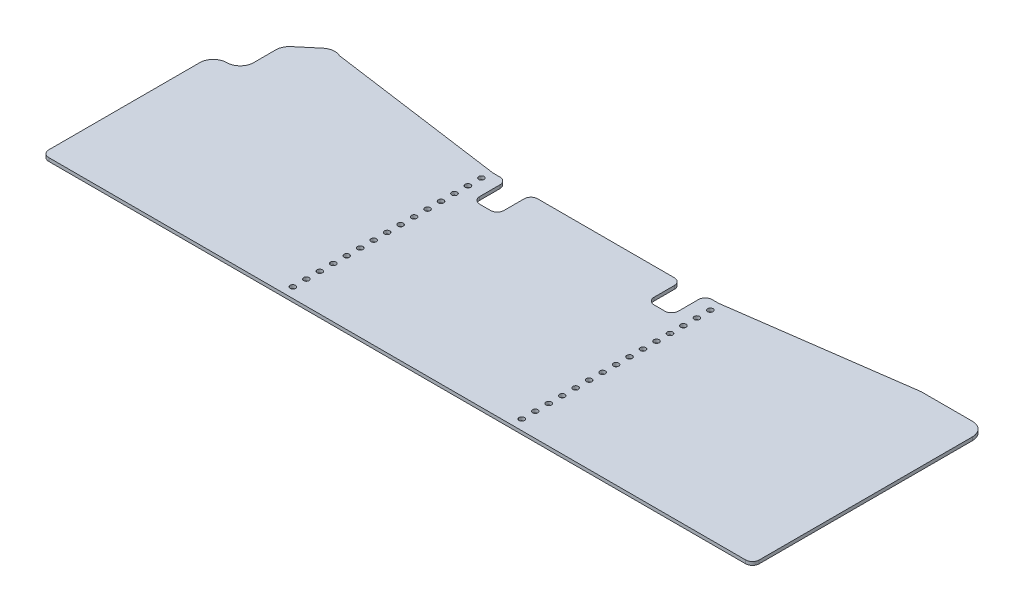
from build123d import *

# Parameters (mm, degrees)
SKETCH1_W           = 225.425
SKETCH1_H           = 196.85
SKETCH1_R           = 2.5527
BOSS_EXTRUDE1_DEPTH = 3.175
FILLET1_R           = 6.35
SKETCH2_W           = 22.86
SKETCH2_H           = 31.75
CUT_EXTRUDE1_DEPTH  = 300.293223695
FILLET2_R           = 6.35
BOSS_EXTRUDE2_DEPTH = 3.175
FILLET3_R           = 6.35
SKETCH4_R           = 2.4892
CUT_EXTRUDE2_DEPTH  = 520.25515638
CUT_EXTRUDE3_DEPTH  = 520.25515638
FILLET4_R           = 12.7
FILLET5_R           = 12.7
CUT_EXTRUDE4_DEPTH  = 520.25515638
FILLET6_R           = 12.7


with BuildPart() as part:
    # Sketch1 → Boss-Extrude1 (new body)
    with BuildSketch(Plane(origin=(0, 0, 0), x_dir=(1, 0, 0), z_dir=(0, 1, 0))):
        with Locations((112.7125, 98.425)):
            Rectangle(SKETCH1_W, SKETCH1_H)
        with Locations(Location((4.7625, 187.325, 0), (0, 0, 270))):
            Circle(SKETCH1_R, mode=Mode.SUBTRACT)
        with Locations(Location((4.7625, 174.625, 0), (0, 0, 270))):
            Circle(SKETCH1_R, mode=Mode.SUBTRACT)
        with Locations(Location((4.7625, 161.925, 0), (0, 0, 270))):
            Circle(SKETCH1_R, mode=Mode.SUBTRACT)
        with Locations(Location((4.7625, 149.225, 0), (0, 0, 270))):
            Circle(SKETCH1_R, mode=Mode.SUBTRACT)
        with Locations(Location((4.7625, 136.525, 0), (0, 0, 270))):
            Circle(SKETCH1_R, mode=Mode.SUBTRACT)
        with Locations(Location((4.7625, 123.825, 0), (0, 0, 270))):
            Circle(SKETCH1_R, mode=Mode.SUBTRACT)
        with Locations(Location((220.6625, 123.825, 0), (0, 0, 90))):
            Circle(SKETCH1_R, mode=Mode.SUBTRACT)
        with Locations(Location((220.6625, 136.525, 0), (0, 0, 90))):
            Circle(SKETCH1_R, mode=Mode.SUBTRACT)
        with Locations(Location((220.6625, 149.225, 0), (0, 0, 90))):
            Circle(SKETCH1_R, mode=Mode.SUBTRACT)
        with Locations(Location((220.6625, 161.925, 0), (0, 0, 90))):
            Circle(SKETCH1_R, mode=Mode.SUBTRACT)
        with Locations(Location((220.6625, 174.625, 0), (0, 0, 90))):
            Circle(SKETCH1_R, mode=Mode.SUBTRACT)
        with Locations(Location((220.6625, 187.325, 0), (0, 0, 90))):
            Circle(SKETCH1_R, mode=Mode.SUBTRACT)
        with Locations(Location((4.7625, 111.125, 0), (0, 0, 270))):
            Circle(SKETCH1_R, mode=Mode.SUBTRACT)
        with Locations(Location((4.7625, 98.425, 0), (0, 0, 270))):
            Circle(SKETCH1_R, mode=Mode.SUBTRACT)
        with Locations(Location((4.7625, 85.725, 0), (0, 0, 270))):
            Circle(SKETCH1_R, mode=Mode.SUBTRACT)
        with Locations(Location((4.7625, 73.025, 0), (0, 0, 270))):
            Circle(SKETCH1_R, mode=Mode.SUBTRACT)
        with Locations(Location((4.7625, 60.325, 0), (0, 0, 270))):
            Circle(SKETCH1_R, mode=Mode.SUBTRACT)
        with Locations(Location((4.7625, 47.625, 0), (0, 0, 270))):
            Circle(SKETCH1_R, mode=Mode.SUBTRACT)
        with Locations(Location((4.7625, 34.925, 0), (0, 0, 270))):
            Circle(SKETCH1_R, mode=Mode.SUBTRACT)
        with Locations(Location((4.7625, 22.225, 0), (0, 0, 270))):
            Circle(SKETCH1_R, mode=Mode.SUBTRACT)
        with Locations(Location((4.7625, 9.525, 0), (0, 0, 270))):
            Circle(SKETCH1_R, mode=Mode.SUBTRACT)
        with Locations(Location((220.6625, 111.125, 0), (0, 0, 90))):
            Circle(SKETCH1_R, mode=Mode.SUBTRACT)
        with Locations(Location((220.6625, 98.425, 0), (0, 0, 90))):
            Circle(SKETCH1_R, mode=Mode.SUBTRACT)
        with Locations(Location((220.6625, 85.725, 0), (0, 0, 90))):
            Circle(SKETCH1_R, mode=Mode.SUBTRACT)
        with Locations(Location((220.6625, 73.025, 0), (0, 0, 90))):
            Circle(SKETCH1_R, mode=Mode.SUBTRACT)
        with Locations(Location((220.6625, 60.325, 0), (0, 0, 90))):
            Circle(SKETCH1_R, mode=Mode.SUBTRACT)
        with Locations(Location((220.6625, 47.625, 0), (0, 0, 90))):
            Circle(SKETCH1_R, mode=Mode.SUBTRACT)
        with Locations(Location((220.6625, 34.925, 0), (0, 0, 90))):
            Circle(SKETCH1_R, mode=Mode.SUBTRACT)
        with Locations(Location((220.6625, 22.225, 0), (0, 0, 90))):
            Circle(SKETCH1_R, mode=Mode.SUBTRACT)
        with Locations(Location((220.6625, 9.525, 0), (0, 0, 90))):
            Circle(SKETCH1_R, mode=Mode.SUBTRACT)
    extrude(amount=BOSS_EXTRUDE1_DEPTH)

    # Fillet1
    fillet1_edges = [part.edges().sort_by_distance(p)[0] for p in [
        (0, 1.5875, -196.85),
        (225.425, 1.5875, -196.85),
        (225.425, 1.5875, 0),
        (0, 1.5875, 0),
    ]]
    fillet(fillet1_edges, radius=FILLET1_R)

    # Sketch2 → Cut-Extrude1 (cut, through all)
    with BuildSketch(Plane(origin=(0, 3.175, 0), x_dir=(1, 0, 0), z_dir=(0, 1, 0))):
        with Locations((30.48, 180.975)):
            Rectangle(SKETCH2_W, SKETCH2_H)
        with Locations((194.945, 180.975)):
            Rectangle(SKETCH2_W, SKETCH2_H)
    extrude(amount=-CUT_EXTRUDE1_DEPTH, mode=Mode.SUBTRACT)

    # Fillet2
    fillet2_edges = [part.edges().sort_by_distance(p)[0] for p in [
        (19.05, 1.5875, -165.1),
        (19.05, 1.5875, -196.85),
        (41.91, 1.5875, -196.85),
        (41.91, 1.5875, -165.1),
        (183.515, 1.5875, -196.85),
        (206.375, 1.5875, -196.85),
        (206.375, 1.5875, -165.1),
        (183.515, 1.5875, -165.1),
    ]]
    fillet(fillet2_edges, radius=FILLET2_R)

    # Sketch3 → Boss-Extrude2 (add)
    with BuildSketch(Plane(origin=(0, 3.175, 0), x_dir=(1, 0, 0), z_dir=(0, 1, 0))):
        with BuildLine():
            ThreePointArc((0, 6.35), (1.859871939, 1.859871939), (6.35, 0))
            Line((6.35, 0), (-222.25, 0))
            Line((-222.25, 0), (-222.25, 263.064500032))
            Line((-222.25, 263.064500032), (-166.6875, 263.064500032))
            Line((-166.6875, 263.064500032), (-166.6875, 220.934871939))
            Line((-166.6875, 220.934871939), (6.35, 196.85))
            ThreePointArc((6.35, 196.85), (1.859871939, 194.990128061), (0, 190.5))
            Line((0, 190.5), (0, 6.35))
        make_face()
        with BuildLine():
            Line((392.1125, 220.934871939), (219.075, 196.85))
            ThreePointArc((219.075, 196.85), (223.565128061, 194.990128061), (225.425, 190.5))
            Line((225.425, 190.5), (225.425, 6.35))
            ThreePointArc((225.425, 6.35), (223.565128061, 1.859871939), (219.075, 0))
            Line((219.075, 0), (447.675, 0))
            Line((447.675, 0), (447.675, 263.064500032))
            Line((447.675, 263.064500032), (392.1125, 263.064500032))
            Line((392.1125, 263.064500032), (392.1125, 220.934871939))
        make_face()
    extrude(amount=-BOSS_EXTRUDE2_DEPTH)

    # Fillet3
    fillet3_edges = [part.edges().sort_by_distance(p)[0] for p in [
        (219.075, 1.5875, -196.85),
        (6.35, 1.5875, -196.85),
        (-222.25, 1.5875, 0),
        (-222.25, 1.5875, -263.064500032),
        (-166.6875, 1.5875, -263.064500032),
        (-166.6875, 1.5875, -220.934871939),
        (447.675, 1.5875, 0),
        (447.675, 1.5875, -263.064500032),
        (392.1125, 1.5875, -263.064500032),
        (392.1125, 1.5875, -220.934871939),
    ]]
    fillet(fillet3_edges, radius=FILLET3_R)

    # Sketch4 → Cut-Extrude2 (cut, through all)
    with BuildSketch(Plane(origin=(0, 3.175, 0), x_dir=(1, 0, 0), z_dir=(0, 1, 0))):
        with Locations(Location((-211.1375, 256.714500032, 0), (0, 0, 270))):
            Circle(SKETCH4_R)
        with Locations((-223.8375, 256.714500032)):
            Circle(SKETCH4_R)
        with Locations(Location((-198.4375, 256.714500032, 0), (0, 0, 270))):
            Circle(SKETCH4_R)
        with Locations(Location((-185.7375, 256.714500032, 0), (0, 0, 270))):
            Circle(SKETCH4_R)
        with Locations(Location((411.1625, 256.714500032, 0), (0, 0, 270))):
            Circle(SKETCH4_R)
        with Locations(Location((423.8625, 256.714500032, 0), (0, 0, 270))):
            Circle(SKETCH4_R)
        with Locations(Location((436.5625, 256.714500032, 0), (0, 0, 270))):
            Circle(SKETCH4_R)
        with Locations((449.2625, 256.714500032)):
            Circle(SKETCH4_R)
    extrude(amount=-CUT_EXTRUDE2_DEPTH, mode=Mode.SUBTRACT)

    # Sketch5 → Cut-Extrude3 (cut, through all)
    with BuildSketch(Plane(origin=(0, 3.175, 0), x_dir=(1, 0, 0), z_dir=(0, 1, 0))):
        with BuildLine():
            Line((-196.85, 201.06223924), (-166.6875, 226.46223924))
            Line((-166.6875, 226.46223924), (-166.6875, 256.714500032))
            ThreePointArc((-166.6875, 256.714500032), (-168.547371939, 261.204628093), (-173.0375, 263.064500032))
            Line((-173.0375, 263.064500032), (-215.9, 263.064500032))
            ThreePointArc((-215.9, 263.064500032), (-219.742708963, 261.769802973), (-222.01844344, 258.413661552))
            ThreePointArc((-222.01844344, 258.413661552), (-221.353386843, 256.55544512), (-222.25, 254.797220608))
            Line((-222.25, 254.797220608), (-222.25, 161.464500032))
            Line((-222.25, 161.464500032), (-196.85, 161.464500032))
            Line((-196.85, 161.464500032), (-196.85, 201.06223924))
        make_face()
    extrude(amount=-CUT_EXTRUDE3_DEPTH, mode=Mode.SUBTRACT)

    # Fillet4
    fillet4_edges = [part.edges().sort_by_distance(p)[0] for p in [
        (-166.6875, 1.5875, -226.46223924),
    ]]
    fillet(fillet4_edges, radius=FILLET4_R)

    # Fillet5
    # the kernel refuses this fillet: 12.7 mm, written as the material it adds along each edge
    with BuildSketch(Plane(origin=(-196.85, 3.175, -161.464500032), x_dir=(0, 0, -1), z_dir=(0, -1, 0))) as fillet5_piece_1:
        with BuildLine():
            CenterArc((FILLET5_R, -FILLET5_R), FILLET5_R, 90, 90)
            Line((0, -FILLET5_R), (0, 0))
            Line((0, 0), (FILLET5_R, 0))
        make_face()
    extrude(amount=3.175)
    # the kernel refuses this fillet: 12.7 mm, written as the material it takes off along each edge
    with BuildSketch(Plane(origin=(-196.85, 17.946244164, -201.06223924), x_dir=(0.7649111981170551, 0, -0.6441357457827745), z_dir=(0, -1, 0))) as fillet5_2_piece_1:
        with BuildLine():
            CenterArc((FILLET5_R * 0.465236036671, FILLET5_R), FILLET5_R, 220.100907546, 49.899092454)
            Line((-FILLET5_R * 0.299675161446, FILLET5_R * 0.355864254217), (0, 0))
            Line((0, 0), (FILLET5_R * 0.465236036671, 0))
        make_face()
    extrude(amount=32.717488329, mode=Mode.SUBTRACT)
    with BuildSketch(Plane(origin=(447.675, -8.095541775, -254.797220608), x_dir=(0, 0, 1), z_dir=(0, 1, 0))) as fillet5_2_piece_2:
        with BuildLine():
            CenterArc((3.23821671, -12.7), FILLET5_R, 90, 19.84145254)
            ThreePointArc((-1.072398787, -0.753929766), (-0.485677324, -0.448828084), (0, 0))
            Line((0, 0), (3.23821671, 0))
        make_face()
    extrude(amount=19.366083551, mode=Mode.SUBTRACT)
    with BuildSketch(Plane(origin=(447.44344344, 35.300659999, -258.413661552), x_dir=(-0.15933009904397483, 0, 0.987225364108235), z_dir=(0, -1, 0))) as fillet5_2_piece_3:
        with BuildLine():
            CenterArc((9.854968596, 10.543603817), FILLET5_R, 170.831985075, 65.287819707)
            Line((-2.682793528, 12.567096075), (-3.936569741, 12.7694453))
            ThreePointArc((-3.936569741, 12.7694453), (-4.870349725, 6.983650334), (-0.53046151, -1.153910996))
            Line((-0.53046151, -1.153910996), (0.707971882, -1.054360382))
            ThreePointArc((0.707971882, -1.054360382), (1.387624889, -0.847346348), (2.067277895, -1.054360382))
            Line((2.067277895, -1.054360382), (2.775249777, 0))
        make_face()
    extrude(amount=67.426319998, mode=Mode.SUBTRACT)
    with BuildSketch(Plane(origin=(-222.25, 34.925, -161.464500032), x_dir=(1, 0, 0), z_dir=(0, -1, 0))) as fillet5_2_piece_4:
        with BuildLine():
            CenterArc((FILLET5_R, FILLET5_R), FILLET5_R, 180, 90)
            Line((0, FILLET5_R), (0, 0))
            Line((0, 0), (FILLET5_R, 0))
        make_face()
    extrude(amount=66.675, mode=Mode.SUBTRACT)

    # Sketch6 → Cut-Extrude4 (cut, through all)
    with BuildSketch(Plane(origin=(0, 3.175, 0), x_dir=(1, 0, 0), z_dir=(0, 1, 0))):
        with BuildLine():
            ThreePointArc((392.1125, 226.46223924), (390.552142427, 222.293087597), (386.637909316, 220.172870549))
            Line((386.637909316, 220.172870549), (447.675, 220.172870549))
            Line((447.675, 220.172870549), (447.675, 251.559003898))
            ThreePointArc((447.675, 251.559003898), (447.494110467, 253.694858088), (446.956594784, 255.769869181))
            ThreePointArc((446.956594784, 255.769869181), (442.270283564, 261.086864235), (435.464337201, 263.064500032))
            Line((435.464337201, 263.064500032), (398.4625, 263.064500032))
            ThreePointArc((398.4625, 263.064500032), (393.972371939, 261.204628093), (392.1125, 256.714500032))
            Line((392.1125, 256.714500032), (392.1125, 226.46223924))
        make_face()
    extrude(amount=-CUT_EXTRUDE4_DEPTH, mode=Mode.SUBTRACT)

    # Fillet6
    fillet6_edges = [part.edges().sort_by_distance(p)[0] for p in [
        (386.637909316, 1.5875, -220.172870549),
        (447.675, 1.5875, -220.172870549),
    ]]
    fillet(fillet6_edges, radius=FILLET6_R)


solid = part.part
